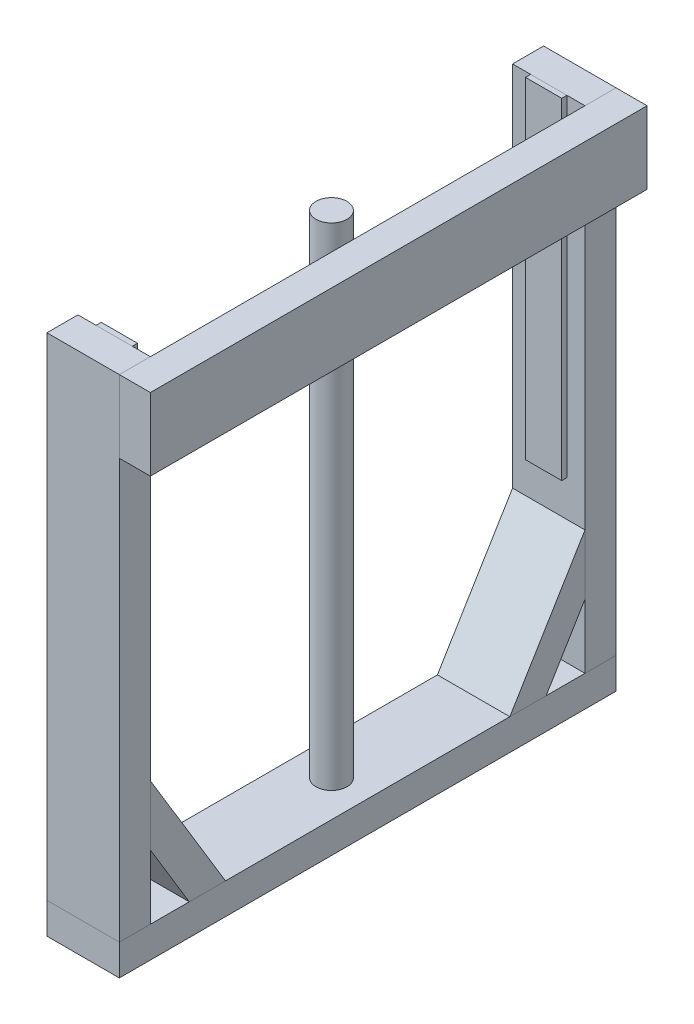
from build123d import *

# Parameters (mm, degrees)
SKETCH1_W                  = 609.6
SKETCH1_H                  = 88.9
TOP_CROSS_SUPPORT_DEPTH    = 38.1
SKETCH2_W                  = 38.1
SKETCH2_H                  = 603.25
LEG_DEPTH                  = 88.9
SKETCH7_W                  = 44.45
SKETCH7_H                  = 406.4
SLIDER_GUIDE_DEPTH         = 6.35
LEG_MIRROR_START           = -304.8
LEG_MIRROR_OUTLINE_W       = 88.9
LEG_MIRROR_OUTLINE_H       = 603.25
LEG_MIRROR_DEPTH           = 38.1
SKETCH4_W                  = 88.9
SKETCH4_H                  = 609.6
BOTTOM_CROSS_SUPPORT_DEPTH = 38.1
LOW_DIAGONAL_SUPPORT_DEPTH = 88.9
SKETCH6_R                  = 19.05
ACTUATOR_DEPTH             = 603.25


# Read off the part's stored shape, not the designer's step: Leg_Mirror
with BuildPart() as part:
    # Sketch1 → Top_Cross_Support (new body)
    with BuildSketch(Plane(origin=(0, 0, 0), x_dir=(0, 0, -1), z_dir=(1, 0, 0))):
        with Locations((0, -44.45)):
            Rectangle(SKETCH1_W, SKETCH1_H)
    extrude(amount=TOP_CROSS_SUPPORT_DEPTH)


with BuildPart() as body_2:
    # Sketch2 → Leg (new body)
    with BuildSketch(Plane.ZY):
        with Locations((285.75, -301.625)):
            Rectangle(SKETCH2_W, SKETCH2_H)
    extrude(amount=LEG_DEPTH)


with BuildPart() as body_3:
    # Sketch7 → Slider_Guide (new body)
    with BuildSketch(Plane(origin=(0, 0, 266.7), x_dir=(-1, 0, 0), z_dir=(0, 0, -1))):
        with Locations((44.45, -203.2)):
            Rectangle(SKETCH7_W, SKETCH7_H)
    extrude(amount=SLIDER_GUIDE_DEPTH)


with BuildPart() as body_4:
    # Leg_Mirror outline → Leg_Mirror (new body)
    with BuildSketch(Plane.XY.offset(LEG_MIRROR_START)):
        with Locations((-44.45, -301.625)):
            Rectangle(LEG_MIRROR_OUTLINE_W, LEG_MIRROR_OUTLINE_H)
    extrude(amount=LEG_MIRROR_DEPTH)


with BuildPart() as body_5:
    # Sketch4 → Bottom_Cross_Support (new body)
    with BuildSketch(Plane.XZ.offset(603.25)):
        with Locations((-44.45, 0)):
            Rectangle(SKETCH4_W, SKETCH4_H)
    extrude(amount=BOTTOM_CROSS_SUPPORT_DEPTH)


with BuildPart() as body_6:
    # Sketch5 → Low_Diagonal_Support (new body)
    with BuildSketch(Plane(origin=(0, 0, 0), x_dir=(0, 0, -1), z_dir=(1, 0, 0))):
        Polygon((-218.981536726, -603.25), (-266.7, -524.422298286), (-266.7, -450.85), (-174.444439521, -603.25), align=None)
    extrude(amount=-LOW_DIAGONAL_SUPPORT_DEPTH)


with BuildPart() as body_7:
    # Low_Diagonal_Support_Mirror: mirrored copy
    add(body_6.part.mirror(Plane.XY))


with BuildPart() as body_8:
    # Sketch6 → Actuator (new body)
    with BuildSketch(Plane(origin=(0, -603.25, 0), x_dir=(1, 0, 0), z_dir=(0, 1, 0))):
        with Locations(Location((-44.45, 0, 0), (0, 0, 270))):
            Circle(SKETCH6_R)
    extrude(amount=ACTUATOR_DEPTH)


with BuildPart() as body_9:
    # Mirror2: mirrored copy
    add(body_3.part.mirror(Plane.XY))


solid = Compound([part.part, body_2.part, body_3.part, body_4.part, body_5.part, body_6.part, body_7.part, body_8.part, body_9.part])
